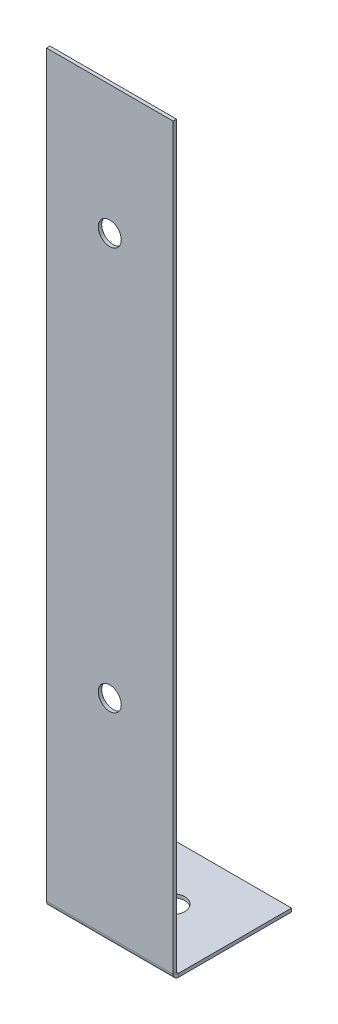
from build123d import *

# Parameters (mm, degrees)
SKETCH1_W              = 44
SKETCH1_H              = 300
BASE_FLANGE1_DEPTH     = 1.2
SKETCHED_START         = -22
SKETCHED_BEND1_DEPTH   = 44
SKETCHED_BEND1_2_DEPTH = 44
SKETCH7_R              = 4
CUT_EXTRUDE1_DEPTH     = 10
SKETCH9_R              = 4.5
CUT_EXTRUDE2_DEPTH     = 10


# Read off the part's stored shape, not the designer's step: Sketched Bend1
# Sheet-metal steps are written as plain solids
with BuildPart() as part:
    # Sketch1 → Base-Flange1 (new body)
    with BuildSketch(Plane(origin=(0, 0, 0), x_dir=(1, 0, 0), z_dir=(0, 1, 0))):
        Rectangle(SKETCH1_W, SKETCH1_H)
    extrude(amount=-BASE_FLANGE1_DEPTH)

    # Sketched Bend1 outline → Sketched Bend1 (cut)
    with BuildSketch(Plane.YZ.offset(SKETCHED_START)):
        with BuildLine():
            ThreePointArc((-1.2, -110.7366), (-0.872269031, -109.658657516), (0, -108.945555612))
            Line((0, -108.945555612), (0, 150))
            Line((0, 150), (-1.2, 150))
            Line((-1.2, 150), (-1.2, -110.7366))
        make_face()
    extrude(amount=SKETCHED_BEND1_DEPTH, mode=Mode.SUBTRACT)

    # Sketched Bend1 2 outline → Sketched Bend1 2 (add)
    with BuildSketch(Plane.YZ.offset(SKETCHED_START)):
        with BuildLine():
            Line((257.6, -110), (257.6, -108.8))
            Line((257.6, -108.8), (0.7366, -108.8))
            ThreePointArc((0.7366, -108.8), (0.361178238, -108.836737358), (0, -108.945555612))
            Line((0, -108.945555612), (0, -110.7366))
            ThreePointArc((0, -110.7366), (0.215745145, -110.215745145), (0.7366, -110))
            Line((0.7366, -110), (257.6, -110))
        make_face()
    extrude(amount=SKETCHED_BEND1_2_DEPTH)

    # Sketch7 → Cut-Extrude1 (cut)
    with BuildSketch(Plane.XY.offset(-108.8)):
        with Locations((0, 72.8)):
            Circle(SKETCH7_R)
        with Locations((0, 212.8)):
            Circle(SKETCH7_R)
    extrude(amount=-CUT_EXTRUDE1_DEPTH, mode=Mode.SUBTRACT)

    # Sketch9 → Cut-Extrude2 (cut)
    with BuildSketch(Plane.XZ.offset(1.2)):
        with Locations(Location((0, -130.3683, 0), (0, 0, 270))):
            Circle(SKETCH9_R)
    extrude(amount=-CUT_EXTRUDE2_DEPTH, mode=Mode.SUBTRACT)


solid = part.part
